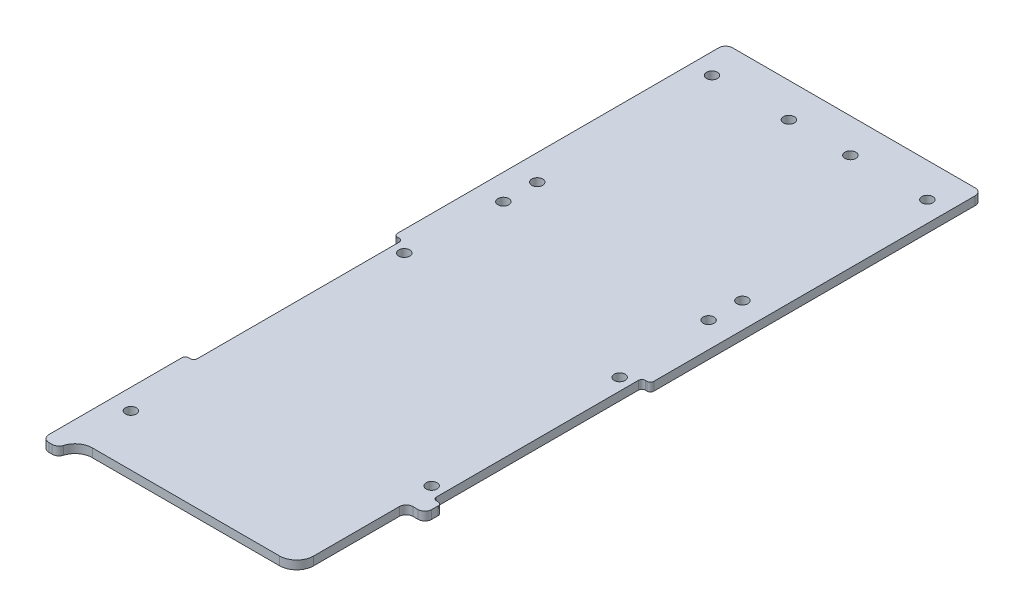
from build123d import *

# Parameters (mm, degrees)
SKETCH1_R               = 2.032
BOSS_EXTRUDE1_DEPTH     = 3.175
FILLET1_R               = 2.54
FILLET2_R               = 2.54
FILLET3_R               = 6.35
CUT_EXTRUDE1_DEPTH      = 136.673215063
FILLET4_R               = 6.35
FILLET5_R               = 2.54
SKETCH3_R               = 2.032
CUT_EXTRUDE2_DEPTH      = 136.673215063
CUT_EXTRUDE3_DEPTH      = 136.673215063
CUT_EXTRUDE3_DEPTH_BACK = 136.673215063
SKETCH4_W               = 3.17499648
SKETCH4_H               = 77.59191576
SKETCH4_W_2             = 3.17500352
FILLET6_R               = 1.27


with BuildPart() as part:
    # Sketch1 → Boss-Extrude1 (new body)
    with BuildSketch(Plane(origin=(0, 0, 0), x_dir=(1, 0, 0), z_dir=(0, 1, 0))):
        Polygon((47.625, 127), (-47.625, 127), (-47.625, -127), (-41.275, -127), (-41.275, -120.65), (41.275, -120.65), (41.275, -127), (47.625, -127), align=None)
        with Locations((-39.999684148, -101.6)):
            Circle(SKETCH1_R, mode=Mode.SUBTRACT)
        with Locations((39.999684148, -69.85)):
            Circle(SKETCH1_R, mode=Mode.SUBTRACT)
        with Locations((-39.999684148, 0)):
            Circle(SKETCH1_R, mode=Mode.SUBTRACT)
        with Locations((-39.999684148, 114.3)):
            Circle(SKETCH1_R, mode=Mode.SUBTRACT)
        with Locations((-11.424684148, 114.3)):
            Circle(SKETCH1_R, mode=Mode.SUBTRACT)
        with Locations((39.999684148, 0)):
            Circle(SKETCH1_R, mode=Mode.SUBTRACT)
        with Locations((11.424684148, 114.3)):
            Circle(SKETCH1_R, mode=Mode.SUBTRACT)
        with Locations((39.999684148, 114.3)):
            Circle(SKETCH1_R, mode=Mode.SUBTRACT)
    extrude(amount=BOSS_EXTRUDE1_DEPTH)

    # Fillet1
    fillet1_edges = [part.edges().sort_by_distance(p)[0] for p in [
        (-47.625, 1.5875, -127),
        (47.625, 1.5875, -127),
        (47.625, 1.5875, 127),
        (-47.625, 1.5875, 127),
    ]]
    fillet(fillet1_edges, radius=FILLET1_R)

    # Fillet2
    fillet2_edges = [part.edges().sort_by_distance(p)[0] for p in [
        (41.275, 1.5875, 127),
        (-41.275, 1.5875, 127),
    ]]
    fillet(fillet2_edges, radius=FILLET2_R)

    # Fillet3
    fillet3_edges = [part.edges().sort_by_distance(p)[0] for p in [
        (41.275, 1.5875, 120.65),
        (-41.275, 1.5875, 120.65),
    ]]
    fillet(fillet3_edges, radius=FILLET3_R)

    # Sketch2 → Cut-Extrude1 (cut, through all)
    with BuildSketch(Plane.XZ):
        with BuildLine():
            Line((47.625, 131.883089137), (41.912259006, 131.883089137))
            Line((41.912259006, 131.883089137), (41.912259006, 126.142610088))
            ThreePointArc((41.912259006, 126.142610088), (41.594413908, 125.693125058), (41.380880287, 125.185714286))
            ThreePointArc((41.380880287, 125.185714286), (41.06807644, 124.354098175), (40.642259006, 123.574283379))
            Line((40.642259006, 123.574283379), (40.642259006, 79.981419179))
            Line((40.642259006, 79.981419179), (47.625, 79.981419179))
            Line((47.625, 79.981419179), (47.625, 131.883089137))
        make_face()
    extrude(amount=-CUT_EXTRUDE1_DEPTH, mode=Mode.SUBTRACT)

    # Fillet4
    fillet4_edges = [part.edges().sort_by_distance(p)[0] for p in [
        (40.642259006, 1.5875, 123.574283379),
    ]]
    fillet(fillet4_edges, radius=FILLET4_R)

    # Fillet5
    fillet5_edges = [part.edges().sort_by_distance(p)[0] for p in [
        (47.625, 1.5875, 79.981419179),
        (40.642259006, 1.5875, 79.981419179),
    ]]
    fillet(fillet5_edges, radius=FILLET5_R)

    # Sketch3 → Cut-Extrude2 (cut, through all)
    with BuildSketch(Plane.XZ):
        with Locations((-38.11166442, -34.913768806)):
            Circle(SKETCH3_R)
        with Locations((-38.11166442, -47.490173279)):
            Circle(SKETCH3_R)
        with Locations((38.11166442, -47.490173279)):
            Circle(SKETCH3_R)
        with Locations((38.11166442, -34.913768806)):
            Circle(SKETCH3_R)
    extrude(amount=-CUT_EXTRUDE2_DEPTH, mode=Mode.SUBTRACT)

    # Sketch4 → Cut-Extrude3 (cut, two sides: drawn at the far end of the back side and taken through both)
    with BuildSketch(Plane(origin=(0, 3.175, 0), x_dir=(1, 0, 0), z_dir=(0, 1, 0)).offset(-CUT_EXTRUDE3_DEPTH_BACK)):
        with Locations((-46.03750176, -34.985947217)):
            Rectangle(SKETCH4_W, SKETCH4_H)
        with Locations((46.03749824, -34.985947217)):
            Rectangle(SKETCH4_W_2, SKETCH4_H)
    extrude(amount=CUT_EXTRUDE3_DEPTH + CUT_EXTRUDE3_DEPTH_BACK, mode=Mode.SUBTRACT)

    # Fillet6
    fillet6_edges = [part.edges().sort_by_distance(p)[0] for p in [
        (-44.45000352, 1.5875, -3.810010663),
        (-44.45000352, 1.5875, 73.781905097),
        (44.44999648, 1.5875, -3.810010663),
        (44.44999648, 1.5875, 73.781905097),
        (47.625, 1.5875, 73.781905097),
        (47.625, 1.5875, -3.810010663),
        (-47.625, 1.5875, 73.781905097),
        (-47.625, 1.5875, -3.810010663),
    ]]
    fillet(fillet6_edges, radius=FILLET6_R)


solid = part.part
